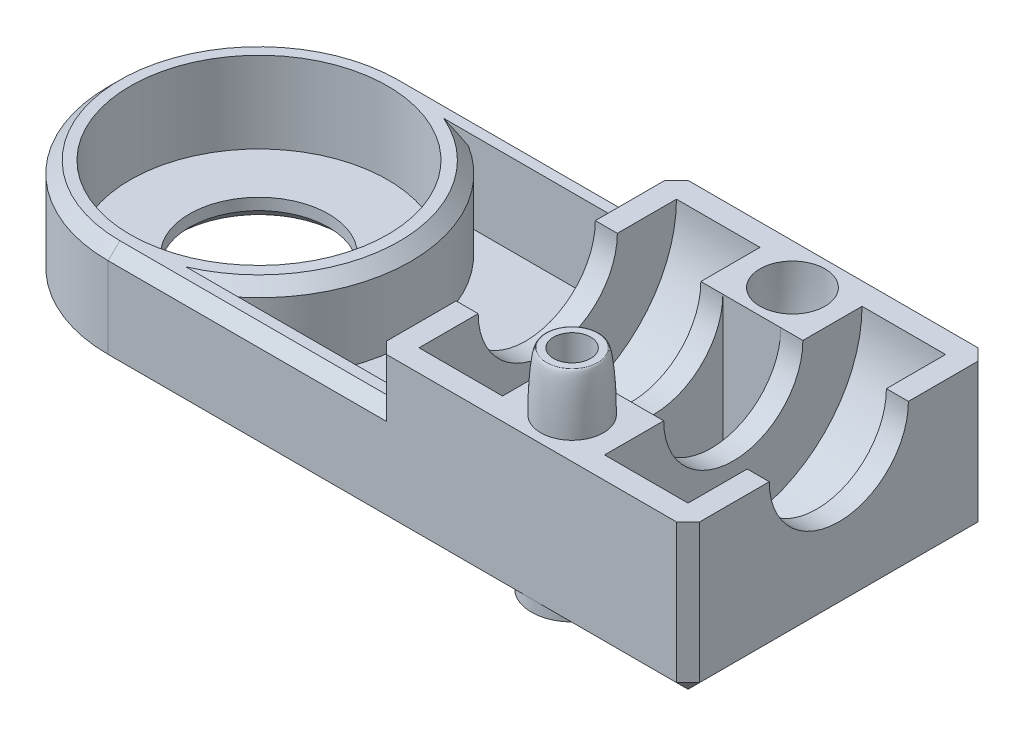
from build123d import *

# Parameters (mm, degrees)
SKETCH1_W           = 27
SKETCH1_H           = 26
BOSS_EXTRUDE1_DEPTH = 2
SKETCH2_W           = 11
SKETCH2_H           = 26
BOSS_EXTRUDE2_DEPTH = 11
CUT_EXTRUDE1_DEPTH  = 3.6
CUT_EXTRUDE2_REACH  = 34.665
SKETCH13_W          = 5
SKETCH13_H          = 7
BOSS_EXTRUDE6_DEPTH = 11
SKETCH14_R          = 2.7
BOSS_EXTRUDE7_DEPTH = 5
SKETCH15_R          = 2.8
CUT_EXTRUDE7_DEPTH  = 5
SKETCH16_R          = 1.6
CUT_EXTRUDE8_DEPTH  = 26.98557292
BOSS_EXTRUDE5_DEPTH = 9
SKETCH10_R          = 11.1
CUT_EXTRUDE4_DEPTH  = 7
SKETCH11_R          = 6
CUT_EXTRUDE5_DEPTH  = 54.621357685
CUT_EXTRUDE6_DEPTH  = 7
BOSS_EXTRUDE9_START = -1
SKETCH17_R          = 3.5
SKETCH17_R_2        = 1.6
BOSS_EXTRUDE9_DEPTH = 1
FILLET1_SIZE        = 5
FILLET1_SIZE_2      = 0.5


with BuildPart() as part:
    # Sketch1 → Boss-Extrude1 (new body)
    with BuildSketch(Plane(origin=(0, 0, 0), x_dir=(1, 0, 0), z_dir=(0, 1, 0))):
        Rectangle(SKETCH1_W, SKETCH1_H)
    extrude(amount=BOSS_EXTRUDE1_DEPTH)

    # Sketch2 → Boss-Extrude2 (add)
    with BuildSketch(Plane(origin=(0, 2, 0), x_dir=(1, 0, 0), z_dir=(0, 1, 0))):
        with Locations((-8, 0)):
            Rectangle(SKETCH2_W, SKETCH2_H)
    boss_extrude2 = extrude(amount=BOSS_EXTRUDE2_DEPTH)

    # Sketch3 → Cut-Extrude1 (cut, symmetric)
    with BuildSketch(Plane.ZY.offset(8)):
        with BuildLine():
            Line((11.1, 13), (-11.1, 13))
            ThreePointArc((-11.1, 13), (0, 1.9), (11.1, 13))
        make_face()
    cut_extrude1 = extrude(amount=CUT_EXTRUDE1_DEPTH, both=True, mode=Mode.SUBTRACT)

    # Cut-Extrude2: up to this face of the body (flat: up to its plane)
    cut_extrude2_end = Plane(part.part.faces().sort_by_distance((-2.5, 7.5, 0))[0])
    # Sketch4 → Cut-Extrude2 (cut, up to the picked face)
    with BuildSketch(Plane.ZY.offset(13.5), mode=Mode.PRIVATE) as cut_extrude2_sk1:
        with BuildLine():
            Line((6, 13), (-6, 13))
            ThreePointArc((-6, 13), (0, 7), (6, 13))
        make_face()
    cut_extrude2_tool1 = split(extrude(cut_extrude2_sk1.sketch, amount=-CUT_EXTRUDE2_REACH, mode=Mode.PRIVATE), bisect_by=cut_extrude2_end, keep=Keep.BOTH, mode=Mode.PRIVATE)
    cut_extrude2 = cut_extrude2_tool1.solids().sort_by(Axis((-13.5, 10.453521, 0), (1, 0, 0)))[0]
    add(cut_extrude2, mode=Mode.SUBTRACT)

    # Mirror3: Boss-Extrude2, Cut-Extrude1, Cut-Extrude2 across plane
    add(boss_extrude2.mirror(Plane(origin=(0, 0, 0), x_dir=(0, 0, 1), z_dir=(1, 0, 0))))
    add(cut_extrude1.mirror(Plane(origin=(0, 0, 0), x_dir=(0, 0, 1), z_dir=(1, 0, 0))), mode=Mode.SUBTRACT)
    add(cut_extrude2.mirror(Plane(origin=(0, 0, 0), x_dir=(0, 0, 1), z_dir=(1, 0, 0))), mode=Mode.SUBTRACT)

    # Sketch13 → Boss-Extrude6 (add)
    with BuildSketch(Plane(origin=(0, 2, 0), x_dir=(1, 0, 0), z_dir=(0, 1, 0))):
        with Locations((0, -9.5)):
            Rectangle(SKETCH13_W, SKETCH13_H)
        with Locations((0, 9.5)):
            Rectangle(SKETCH13_W, SKETCH13_H)
    extrude(amount=BOSS_EXTRUDE6_DEPTH)

    # Sketch14 → Boss-Extrude7 (add)
    with BuildSketch(Plane(origin=(0, 13, 0), x_dir=(1, 0, 0), z_dir=(0, 1, 0))):
        with Locations(Location((0, -9.5, 0), (0, 0, 90))):
            Circle(SKETCH14_R)
    extrude(amount=BOSS_EXTRUDE7_DEPTH)

    # Sketch15 → Cut-Extrude7 (cut)
    with BuildSketch(Plane(origin=(0, 13, 0), x_dir=(1, 0, 0), z_dir=(0, 1, 0))):
        with Locations(Location((0, 9.5, 0), (0, 0, 270))):
            Circle(SKETCH15_R)
    extrude(amount=-CUT_EXTRUDE7_DEPTH, mode=Mode.SUBTRACT)

    # Sketch16 → Cut-Extrude8 (cut, through all)
    with BuildSketch(Plane(origin=(0, 18, 0), x_dir=(1, 0, 0), z_dir=(0, 1, 0))):
        with Locations(Location((0, -9.5, 0), (0, 0, 270))):
            Circle(SKETCH16_R)
        with Locations(Location((0, 9.5, 0), (0, 0, 270))):
            Circle(SKETCH16_R)
    extrude(amount=-CUT_EXTRUDE8_DEPTH, mode=Mode.SUBTRACT)

    # Sketch9 → Boss-Extrude5 (add)
    with BuildSketch(Plane(origin=(0, 0, 0), x_dir=(1, 0, 0), z_dir=(0, 1, 0))):
        with BuildLine():
            Line((-13.5, 13), (-13.5, -13))
            Line((-13.5, -13), (-36.5, -13))
            ThreePointArc((-36.5, -13), (-49.5, 0), (-36.5, 13))
            Line((-36.5, 13), (-13.5, 13))
        make_face()
    extrude(amount=BOSS_EXTRUDE5_DEPTH)

    # Sketch10 → Cut-Extrude4 (cut)
    with BuildSketch(Plane(origin=(0, 9, 0), x_dir=(1, 0, 0), z_dir=(0, 1, 0))):
        with Locations(Location((-36.5, 0, 0), (0, 0, 270))):
            Circle(SKETCH10_R)
    extrude(amount=-CUT_EXTRUDE4_DEPTH, mode=Mode.SUBTRACT)

    # Sketch11 → Cut-Extrude5 (cut, through all)
    with BuildSketch(Plane(origin=(0, 2, 0), x_dir=(1, 0, 0), z_dir=(0, 1, 0))):
        with Locations(Location((-36.5, 0, 0), (0, 0, 270))):
            Circle(SKETCH11_R)
    extrude(amount=-CUT_EXTRUDE5_DEPTH, mode=Mode.SUBTRACT)

    # Sketch12 → Cut-Extrude6 (cut)
    with BuildSketch(Plane(origin=(0, 9, 0), x_dir=(1, 0, 0), z_dir=(0, 1, 0))):
        with BuildLine():
            Line((-29.542989148, -11.1), (-13.5, -11.1))
            Line((-13.5, -11.1), (-13.5, 11.1))
            Line((-13.5, 11.1), (-29.542989148, 11.1))
            ThreePointArc((-29.542989148, 11.1), (-23.4, 0), (-29.542989148, -11.1))
        make_face()
    extrude(amount=-CUT_EXTRUDE6_DEPTH, mode=Mode.SUBTRACT)

    # Chamfer4
    # the kernel refuses this chamfer: 1 mm, written as the material it takes off along each edge
    with BuildSketch(Plane(origin=(12.833333333, 0.666666667, 12.333333333), x_dir=(0.7071067811865475, 0, -0.7071067811865475), z_dir=(0.5773502691896257, -0.5773502691896258, 0.5773502691896257)), Plane(origin=(12.833333333, 0.666666667, -12.333333333), x_dir=(-0.7071067811865475, 0, -0.7071067811865475), z_dir=(0.5773502691896257, -0.5773502691896258, -0.5773502691896257))) as chamfer4_piece_1:
        Polygon((-0.707106781, 0.40824829), (0.707106781, 0.40824829), (0, -0.816496581), align=None)
    extrude(amount=1.270170592, mode=Mode.SUBTRACT)
    with BuildSketch(Plane(origin=(-36.5, 0, 0), x_dir=(0, 0, 1), z_dir=(1, 0, 0))) as chamfer4_piece_2:
        with BuildLine():
            Line((13.028284271, -1.028284271), (11.971715729, 0.028284271))
            Line((11.971715729, 0.028284271), (11.971715729, 0.048284271))
            ThreePointArc((11.971715729, 0.048284271), (12.485857864, 0.02), (13, 0.02))
            Line((13, 0.02), (13.02, 0))
            ThreePointArc((13.02, 0), (13.02, -0.514142136), (13.048284271, -1.028284271))
            Line((13.048284271, -1.028284271), (13.028284271, -1.028284271))
        make_face()
    revolve(axis=Axis((-36.5, 0, 0), (0, -1, 0)), revolution_arc=180, mode=Mode.SUBTRACT)
    with BuildSketch(Plane(origin=(-13.5, 9, 13), x_dir=(0, -0.9996219169112968, 0.027495876610585623), z_dir=(-1, 0, 0))) as chamfer4_piece_3:
        with BuildLine():
            Line((1.028673195, 0), (-0.056547155, -1.027117794))
            Line((-0.056547155, -1.027117794), (-0.076539593, -1.026567876))
            ThreePointArc((-0.076539593, -1.026567876), (-0.034129227, -0.51339783), (-0.019992438, 0.000549918))
            Line((-0.019992438, 0.000549918), (0.000549918, 0.019992438))
            ThreePointArc((0.000549918, 0.019992438), (0.514497665, 0.00585565), (1.029223113, 0.019992438))
            Line((1.029223113, 0.019992438), (1.028673195, 0))
        make_face()
    extrude(amount=23, mode=Mode.SUBTRACT)
    with BuildSketch(Plane(origin=(-36.5, 9, -13), x_dir=(0, 0.027495876610585647, 0.9996219169112968), z_dir=(1, 0, 0))) as chamfer4_piece_4:
        with BuildLine():
            Line((1.028673195, 0), (-0.056547155, 1.027117794))
            Line((-0.056547155, 1.027117794), (-0.076539593, 1.026567876))
            ThreePointArc((-0.076539593, 1.026567876), (-0.034129227, 0.51339783), (-0.019992438, -0.000549918))
            Line((-0.019992438, -0.000549918), (0.000549918, -0.019992438))
            ThreePointArc((0.000549918, -0.019992438), (0.514497665, -0.00585565), (1.029223113, -0.019992438))
            Line((1.029223113, -0.019992438), (1.028673195, 0))
        make_face()
    extrude(amount=23, mode=Mode.SUBTRACT)
    with BuildSketch(Plane(origin=(-36.5, 9, 0), x_dir=(0, 0, 1), z_dir=(1, 0, 0))) as chamfer4_piece_5:
        with BuildLine():
            Line((11.971715729, -0.028284271), (13.028284271, 1.028284271))
            Line((13.028284271, 1.028284271), (13.048284271, 1.028284271))
            ThreePointArc((13.048284271, 1.028284271), (13.02, 0.514142136), (13.02, 0))
            Line((13.02, 0), (13, -0.02))
            ThreePointArc((13, -0.02), (12.485857864, -0.02), (11.971715729, -0.048284271))
            Line((11.971715729, -0.048284271), (11.971715729, -0.028284271))
        make_face()
    revolve(axis=Axis((-36.5, 9, 0), (0, -1, 0)), revolution_arc=180, mode=Mode.SUBTRACT)
    with BuildSketch(Plane(origin=(-36.5, 0, 0), x_dir=(0, 0, 1), z_dir=(-1, 0, 0))) as chamfer4_piece_6:
        with BuildLine():
            Line((5.971715729, 1.028284271), (7.028284271, -0.028284271))
            Line((7.028284271, -0.028284271), (7.028284271, -0.048284271))
            ThreePointArc((7.028284271, -0.048284271), (6.514142136, -0.02), (6, -0.02))
            Line((6, -0.02), (5.98, 0))
            ThreePointArc((5.98, 0), (5.98, 0.514142136), (5.951715729, 1.028284271))
            Line((5.951715729, 1.028284271), (5.971715729, 1.028284271))
        make_face()
    revolve(axis=Axis((-36.5, 0, 0), (0, 1, 0)), mode=Mode.SUBTRACT)
    with BuildSketch(Plane(origin=(-36.5, 9, 0), x_dir=(0.35547288647586206, 0, -0.934686592917925), z_dir=(-0.934686592917925, 0, -0.35547288647586206))) as chamfer4_piece_7_section:
        with BuildLine():
            Line((12.071715729, -0.028284271), (13.128284271, 1.028284271))
            Line((13.128284271, 1.028284271), (13.148284271, 1.028284271))
            ThreePointArc((13.148284271, 1.028284271), (13.12, 0.514142136), (13.12, 0))
            Line((13.12, 0), (13.1, -0.02))
            ThreePointArc((13.1, -0.02), (12.585857864, -0.02), (12.071715729, -0.048284271))
            Line((12.071715729, -0.048284271), (12.071715729, -0.028284271))
        make_face()
    chamfer4_piece_7 = revolve(axis=Axis((-36.5, 9, 0), (0, -1, 0)), revolution_arc=138.355141446, mode=Mode.PRIVATE)
    chamfer4_piece_7 = split(chamfer4_piece_7, bisect_by=Plane(origin=(-23.882630436, 8.517369564, -11.1), z_dir=(0, 0, 1)), keep=Keep.TOP, mode=Mode.PRIVATE)
    chamfer4_piece_7 = split(chamfer4_piece_7, bisect_by=Plane(origin=(-23.882630436, 8.517369564, 11.1), z_dir=(0, 0, -1)), keep=Keep.TOP, mode=Mode.PRIVATE)
    add(chamfer4_piece_7, mode=Mode.SUBTRACT)
    with BuildSketch(Plane(origin=(-36.5, 0, 13), x_dir=(0, 0.999621916911297, 0.02749587661058045), z_dir=(1, 0, 0))) as chamfer4_piece_8:
        with BuildLine():
            Line((1.028673195, 0), (-0.056547155, -1.027117794))
            Line((-0.056547155, -1.027117794), (-0.076539593, -1.026567876))
            ThreePointArc((-0.076539593, -1.026567876), (-0.034129227, -0.51339783), (-0.019992438, 0.000549918))
            Line((-0.019992438, 0.000549918), (0.000549918, 0.019992438))
            ThreePointArc((0.000549918, 0.019992438), (0.514497665, 0.00585565), (1.029223113, 0.019992438))
            Line((1.029223113, 0.019992438), (1.028673195, 0))
        make_face()
    extrude(amount=52.571682988, mode=Mode.SUBTRACT)
    with BuildSketch(Plane(origin=(-36.5, 0, -13), x_dir=(0, 0.9996219169112965, -0.027495876610590803), z_dir=(1, 0, 0))) as chamfer4_piece_9:
        with BuildLine():
            Line((1.028673195, 0), (-0.056547155, 1.027117794))
            Line((-0.056547155, 1.027117794), (-0.076539593, 1.026567876))
            ThreePointArc((-0.076539593, 1.026567876), (-0.034129227, 0.51339783), (-0.019992438, -0.000549918))
            Line((-0.019992438, -0.000549918), (0.000549918, -0.019992438))
            ThreePointArc((0.000549918, -0.019992438), (0.514497665, -0.00585565), (1.029223113, -0.019992438))
            Line((1.029223113, -0.019992438), (1.028673195, 0))
        make_face()
    extrude(amount=52.571682988, mode=Mode.SUBTRACT)
    with BuildSketch(Plane(origin=(13.5, 0, 15.571682988), x_dir=(-0.9996219169112968, -0.02749587661058639, 0), z_dir=(0, 0, -1))) as chamfer4_piece_10:
        with BuildLine():
            Line((1.028673195, 0), (-0.056547155, 1.027117794))
            Line((-0.056547155, 1.027117794), (-0.076539593, 1.026567876))
            ThreePointArc((-0.076539593, 1.026567876), (-0.034129227, 0.51339783), (-0.019992438, -0.000549918))
            Line((-0.019992438, -0.000549918), (0.000549918, -0.019992438))
            ThreePointArc((0.000549918, -0.019992438), (0.514497665, -0.00585565), (1.029223113, -0.019992438))
            Line((1.029223113, -0.019992438), (1.028673195, 0))
        make_face()
    extrude(amount=31.143365976, mode=Mode.SUBTRACT)
    with BuildSketch(Plane(origin=(13.5, -2.571682988, 13), x_dir=(-0.9996219169112968, 0, 0.027495876610585647), z_dir=(0, 1, 0))) as chamfer4_piece_11:
        with BuildLine():
            Line((1.028673195, 0), (-0.056547155, -1.027117794))
            Line((-0.056547155, -1.027117794), (-0.076539593, -1.026567876))
            ThreePointArc((-0.076539593, -1.026567876), (-0.034129227, -0.51339783), (-0.019992438, 0.000549918))
            Line((-0.019992438, 0.000549918), (0.000549918, 0.019992438))
            ThreePointArc((0.000549918, 0.019992438), (0.514497665, 0.00585565), (1.029223113, 0.019992438))
            Line((1.029223113, 0.019992438), (1.028673195, 0))
        make_face()
    extrude(amount=18.143365976, mode=Mode.SUBTRACT)
    with BuildSketch(Plane(origin=(-13.5, 15.571682988, 13), x_dir=(0.9996219169112968, 0, 0.027495876610585647), z_dir=(0, -1, 0))) as chamfer4_piece_12:
        with BuildLine():
            Line((1.028673195, 0), (-0.056547155, -1.027117794))
            Line((-0.056547155, -1.027117794), (-0.076539593, -1.026567876))
            ThreePointArc((-0.076539593, -1.026567876), (-0.034129227, -0.51339783), (-0.019992438, 0.000549918))
            Line((-0.019992438, 0.000549918), (0.000549918, 0.019992438))
            ThreePointArc((0.000549918, 0.019992438), (0.514497665, 0.00585565), (1.029223113, 0.019992438))
            Line((1.029223113, 0.019992438), (1.028673195, 0))
        make_face()
    extrude(amount=6.571682988, mode=Mode.SUBTRACT)
    with BuildSketch(Plane(origin=(-13.5, 15.571682988, -13), x_dir=(0.9996219169112968, 0, -0.027495876610585647), z_dir=(0, -1, 0))) as chamfer4_piece_13:
        with BuildLine():
            Line((1.028673195, 0), (-0.056547155, 1.027117794))
            Line((-0.056547155, 1.027117794), (-0.076539593, 1.026567876))
            ThreePointArc((-0.076539593, 1.026567876), (-0.034129227, 0.51339783), (-0.019992438, -0.000549918))
            Line((-0.019992438, -0.000549918), (0.000549918, -0.019992438))
            ThreePointArc((0.000549918, -0.019992438), (0.514497665, -0.00585565), (1.029223113, -0.019992438))
            Line((1.029223113, -0.019992438), (1.028673195, 0))
        make_face()
    extrude(amount=6.571682988, mode=Mode.SUBTRACT)
    with BuildSketch(Plane(origin=(13.5, -2.571682988, -13), x_dir=(-0.9996219169112968, 0, -0.027495876610585647), z_dir=(0, 1, 0))) as chamfer4_piece_14:
        with BuildLine():
            Line((1.028673195, 0), (-0.056547155, 1.027117794))
            Line((-0.056547155, 1.027117794), (-0.076539593, 1.026567876))
            ThreePointArc((-0.076539593, 1.026567876), (-0.034129227, 0.51339783), (-0.019992438, -0.000549918))
            Line((-0.019992438, -0.000549918), (0.000549918, -0.019992438))
            ThreePointArc((0.000549918, -0.019992438), (0.514497665, -0.00585565), (1.029223113, -0.019992438))
            Line((1.029223113, -0.019992438), (1.028673195, 0))
        make_face()
    extrude(amount=18.143365976, mode=Mode.SUBTRACT)
    with BuildSketch(Plane(origin=(-13.5, 15.571682988, 13), x_dir=(0.9996219169112968, 0, 0.027495876610585647), z_dir=(0, -1, 0))) as chamfer4_piece_15a_section:
        with BuildLine():
            Line((1.028673195, 0), (-0.056547155, -1.027117794))
            Line((-0.056547155, -1.027117794), (-0.076539593, -1.026567876))
            ThreePointArc((-0.076539593, -1.026567876), (-0.034129227, -0.51339783), (-0.019992438, 0.000549918))
            Line((-0.019992438, 0.000549918), (0.000549918, 0.019992438))
            ThreePointArc((0.000549918, 0.019992438), (0.514497665, 0.00585565), (1.029223113, 0.019992438))
            Line((1.029223113, 0.019992438), (1.028673195, 0))
        make_face()
    chamfer4_piece_15a = extrude(amount=9.143365976, mode=Mode.PRIVATE)
    chamfer4_piece_15a = split(chamfer4_piece_15a, bisect_by=Plane(origin=(-13.170206373, 9, 12.670206373), z_dir=(0, -1, 0)), keep=Keep.TOP, mode=Mode.PRIVATE)
    with BuildSketch(Plane(origin=(-10.928317012, 9, 13), x_dir=(0, -0.9996219169112968, 0.027495876610585623), z_dir=(-1, 0, 0))) as chamfer4_piece_15b_section:
        with BuildLine():
            Line((1.028673195, 0), (-0.056547155, -1.027117794))
            Line((-0.056547155, -1.027117794), (-0.076539593, -1.026567876))
            ThreePointArc((-0.076539593, -1.026567876), (-0.034129227, -0.51339783), (-0.019992438, 0.000549918))
            Line((-0.019992438, 0.000549918), (0.000549918, 0.019992438))
            ThreePointArc((0.000549918, 0.019992438), (0.514497665, 0.00585565), (1.029223113, 0.019992438))
            Line((1.029223113, 0.019992438), (1.028673195, 0))
        make_face()
    chamfer4_piece_15b = extrude(amount=25.571682988, mode=Mode.PRIVATE)
    chamfer4_piece_15b = split(chamfer4_piece_15b, bisect_by=Plane(origin=(-13.5, 8.670206373, 12.670206373), z_dir=(1, 0, 0)), keep=Keep.TOP, mode=Mode.PRIVATE)
    chamfer4_piece_15 = chamfer4_piece_15a & chamfer4_piece_15b
    add(chamfer4_piece_15, mode=Mode.SUBTRACT)
    with BuildSketch(Plane(origin=(-36.5, 9, -13), x_dir=(0, 0.027495876610585647, 0.9996219169112968), z_dir=(1, 0, 0))) as chamfer4_piece_16a_section:
        with BuildLine():
            Line((1.028673195, 0), (-0.056547155, 1.027117794))
            Line((-0.056547155, 1.027117794), (-0.076539593, 1.026567876))
            ThreePointArc((-0.076539593, 1.026567876), (-0.034129227, 0.51339783), (-0.019992438, -0.000549918))
            Line((-0.019992438, -0.000549918), (0.000549918, -0.019992438))
            ThreePointArc((0.000549918, -0.019992438), (0.514497665, -0.00585565), (1.029223113, -0.019992438))
            Line((1.029223113, -0.019992438), (1.028673195, 0))
        make_face()
    chamfer4_piece_16a = extrude(amount=25.571682988, mode=Mode.PRIVATE)
    chamfer4_piece_16a = split(chamfer4_piece_16a, bisect_by=Plane(origin=(-13.5, 8.670206373, -12.670206373), z_dir=(1, 0, 0)), keep=Keep.TOP, mode=Mode.PRIVATE)
    with BuildSketch(Plane(origin=(-13.5, 15.571682988, -13), x_dir=(0.9996219169112968, 0, -0.027495876610585647), z_dir=(0, -1, 0))) as chamfer4_piece_16b_section:
        with BuildLine():
            Line((1.028673195, 0), (-0.056547155, 1.027117794))
            Line((-0.056547155, 1.027117794), (-0.076539593, 1.026567876))
            ThreePointArc((-0.076539593, 1.026567876), (-0.034129227, 0.51339783), (-0.019992438, -0.000549918))
            Line((-0.019992438, -0.000549918), (0.000549918, -0.019992438))
            ThreePointArc((0.000549918, -0.019992438), (0.514497665, -0.00585565), (1.029223113, -0.019992438))
            Line((1.029223113, -0.019992438), (1.028673195, 0))
        make_face()
    chamfer4_piece_16b = extrude(amount=9.143365976, mode=Mode.PRIVATE)
    chamfer4_piece_16b = split(chamfer4_piece_16b, bisect_by=Plane(origin=(-13.170206373, 9, -12.670206373), z_dir=(0, -1, 0)), keep=Keep.TOP, mode=Mode.PRIVATE)
    chamfer4_piece_16 = chamfer4_piece_16a & chamfer4_piece_16b
    add(chamfer4_piece_16, mode=Mode.SUBTRACT)

    # Sketch17 → Boss-Extrude9 (add)
    # profile 1 of 2: a face of its own
    with BuildSketch(Plane.XZ.offset(BOSS_EXTRUDE9_START)):
        with Locations((0, -9.5)):
            Circle(SKETCH17_R)
        with Locations(Location((0, -9.5, 0), (0, 0, 90))):
            Circle(SKETCH17_R_2, mode=Mode.SUBTRACT)
    # profile 2 of 2: a face of its own
    with BuildSketch(Plane.XZ.offset(BOSS_EXTRUDE9_START)):
        with Locations((0, 9.5)):
            Circle(SKETCH17_R)
        with Locations(Location((0, 9.5, 0), (0, 0, 90))):
            Circle(SKETCH17_R_2, mode=Mode.SUBTRACT)
    extrude(amount=BOSS_EXTRUDE9_DEPTH)

    # Fillet1
    # an asymmetric fillet: 5, 0.5 mm, written as the material it adds along each edge
    with BuildSketch(Plane(origin=(0, 8, -9.5), x_dir=(0, 0, 1), z_dir=(-1, 0, 0))) as fillet1_piece_1:
        with BuildLine():
            Bezier((2.8, FILLET1_SIZE), (2.8, 0), (2.8 - FILLET1_SIZE_2, 0), weights=[1, 0.707106781, 1])
            Line((2.8 - FILLET1_SIZE_2, 0), (2.8, 0))
            Line((2.8, 0), (2.8, FILLET1_SIZE))
        make_face()
    revolve(axis=Axis((0, 8, -9.5), (0, 1, 0)))
    # an asymmetric fillet: 5, 0.5 mm, written as the material it takes off along each edge
    with BuildSketch(Plane(origin=(0, 18, 9.5), x_dir=(0, 0, -1), z_dir=(1, 0, 0))) as fillet1_2_piece_1:
        with BuildLine():
            Bezier((2.7, -FILLET1_SIZE), (2.7, 0), (2.7 - FILLET1_SIZE_2, 0), weights=[1, 0.707106781, 1])
            Line((2.7 - FILLET1_SIZE_2, 0), (2.7, 0))
            Line((2.7, 0), (2.7, -FILLET1_SIZE))
        make_face()
    revolve(axis=Axis((0, 18, 9.5), (0, 1, 0)), mode=Mode.SUBTRACT)


solid = part.part
